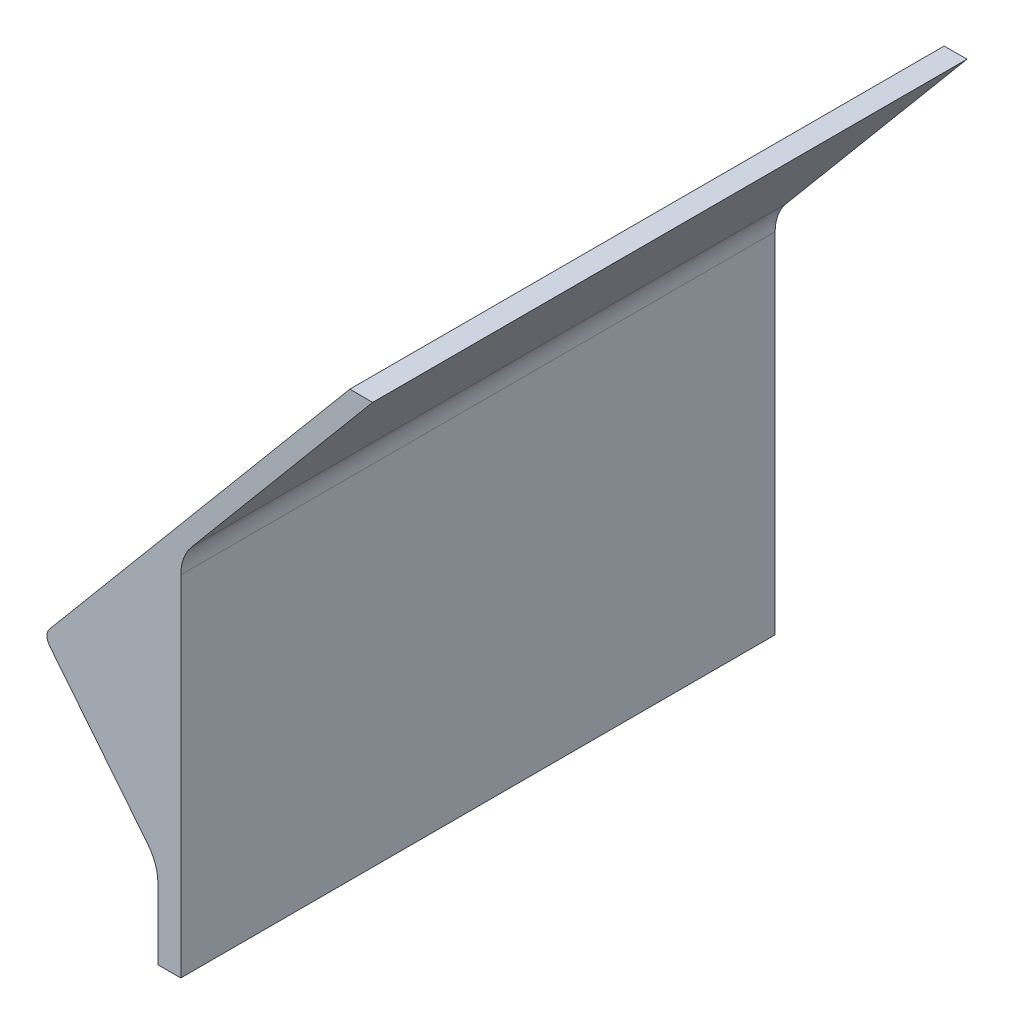
from build123d import *

# Parameters (mm, degrees)
FUNNEL_RIGHT_SIDE_DEPTH = 130
FILLET2_R               = 10
FILLET3_R               = 2.5


with BuildPart() as part:
    # Sketch1 → Funnel - Right Side (new body)
    with BuildSketch(Plane.XY):
        Polygon((0, 0), (0, 80), (41.974030913, 130.022702136), (36.974030913, 130.022702136), (-30, 50.206160185), (-5, 18.981170193), (-5, 0), align=None)
    extrude(amount=FUNNEL_RIGHT_SIDE_DEPTH)

    # Fillet2
    fillet2_edges = [part.edges().sort_by_distance(p)[0] for p in [
        (0, 80, 65),
        (-5, 18.981170193, 65),
    ]]
    fillet(fillet2_edges, radius=FILLET2_R)

    # Fillet3
    fillet3_edges = [part.edges().sort_by_distance(p)[0] for p in [
        (-30, 50.206160185, 65),
    ]]
    fillet(fillet3_edges, radius=FILLET3_R)


solid = part.part
